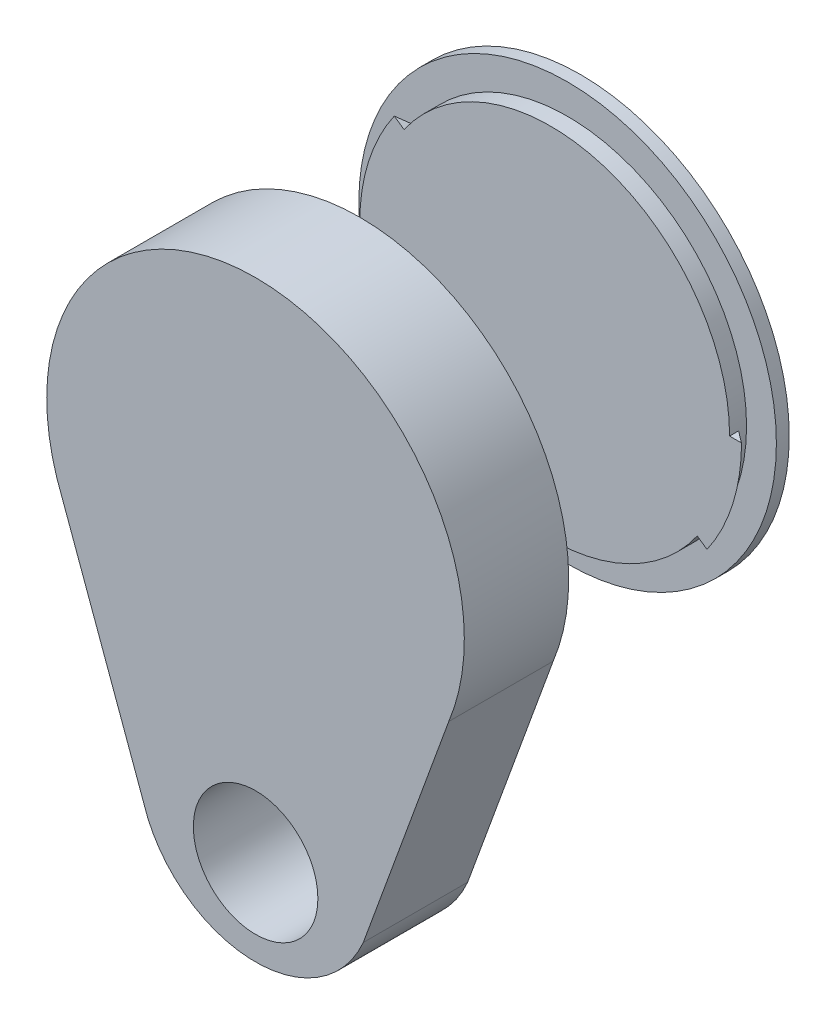
from build123d import *

# Parameters (mm, degrees)
BOSS_EXTRU_4_DEPTH           = 7
ESQUISSE11_R                 = 4.175305872
ENL_V_MAT_EXTRU_2_DEPTH      = 7
R_VOLUTION3_ANGLE            = 35
R_P_TITION_CIRCULAIRE1_COUNT = 2
R_VOLUTION4_ANGLE            = 140
R_P_TITION_CIRCULAIRE2_COUNT = 2


with BuildPart() as part:
    # Esquisse1 → Révolution1 (revolve)
    with BuildSketch(Plane(origin=(1.309044262, 0, 0), x_dir=(1, 0, 0), z_dir=(0, 1, 0))):
        Polygon((0.253488225, -3.046040946), (-13.746511775, -3.046040946), (-13.746511775, 3.953959054), (-12.746511775, 3.953959054), (-12.746511775, 3.442939457), (-12.746511775, 2.953959054), (-12.746511775, -2.046040946), (0.253488225, -2.046040946), align=None)
    revolve(axis=Axis((1.562532487, 0, 2.046040946), (0, 0, 1)))

    # Esquisse10 → Boss.-Extru.4 (add)
    with BuildSketch(Plane.XY.offset(3.046040946)):
        with BuildLine():
            Line((14.88883966, -4.290633652), (8.788835843, -21))
            ThreePointArc((8.788835843, -21), (1.562532487, -25.748246952), (-5.663770869, -21))
            Line((-5.663770869, -21), (-11.763774686, -4.290633652))
            ThreePointArc((-11.763774686, -4.290633652), (1.562532487, -13.260227708), (14.88883966, -4.290633652))
        make_face()
    extrude(amount=-BOSS_EXTRU_4_DEPTH)

    # Esquisse11 → Enlèv. mat.-Extru.2 (cut)
    with BuildSketch(Plane.XY.offset(3.046040946)):
        with Locations((1.568835843, -19.970784203)):
            Circle(ESQUISSE11_R)
    extrude(amount=-ENL_V_MAT_EXTRU_2_DEPTH, mode=Mode.SUBTRACT)

    # Esquisse14 → Révolution4 (revolve)
    with BuildSketch(Plane(origin=(0, 0, 0), x_dir=(1, 0, 0), z_dir=(0, 1, 0))):
        Polygon((-11.437467513, 3.953959054), (-10.437467513, 3.953959054), (-11.437467513, 3.453959054), align=None)
    r_volution4 = revolve(axis=Axis((1.562532487, 0, 2.046040946), (0, 0, -1)), revolution_arc=R_VOLUTION4_ANGLE)

    # Répétition circulaire2: Révolution4 ×2 about axis
    r_p_tition_circulaire2_axis = Axis((1.562532487, 0, 2.046040946), (0, 0, -1))
    for i in range(1, R_P_TITION_CIRCULAIRE2_COUNT):
        add(r_volution4.rotate(r_p_tition_circulaire2_axis, i * 360 / R_P_TITION_CIRCULAIRE2_COUNT))


with BuildPart() as body_2:
    # Esquisse2 → Révolution2 (revolve)
    with BuildSketch(Plane(origin=(0, 0, -11.80070304), x_dir=(1, 0, 0), z_dir=(0, 1, 0))):
        Polygon((0.663591956, 5.841333496), (-11.336408044, 5.841333496), (-11.336408044, 6.365484161), (-11.336408044, 6.97833407), (-13.336408044, 6.97833407), (-13.336408044, 7.841333496), (0.663591956, 7.841333496), align=None)
    revolve(axis=Axis((0.663591956, 0, -19.642036537), (0, 0, 1)))

    # Esquisse13 → Révolution3 (revolve)
    with BuildSketch(Plane(origin=(0, 0, 0), x_dir=(1, 0, 0), z_dir=(0, 1, 0))):
        Polygon((-11.336408044, 17.642036537), (-12.136408044, 17.642036537), (-11.336408044, 18.242036537), align=None)
    r_volution3 = revolve(axis=Axis((0.663591956, 0, -17.642036537), (0, 0, -1)), revolution_arc=R_VOLUTION3_ANGLE)

    # Répétition circulaire1: Révolution3 ×2 about axis
    r_p_tition_circulaire1_axis = Axis((0.663591956, 0, -17.642036537), (0, 0, -1))
    for i in range(1, R_P_TITION_CIRCULAIRE1_COUNT):
        add(r_volution3.rotate(r_p_tition_circulaire1_axis, i * 360 / R_P_TITION_CIRCULAIRE1_COUNT))


solid = Compound([part.part, body_2.part])
